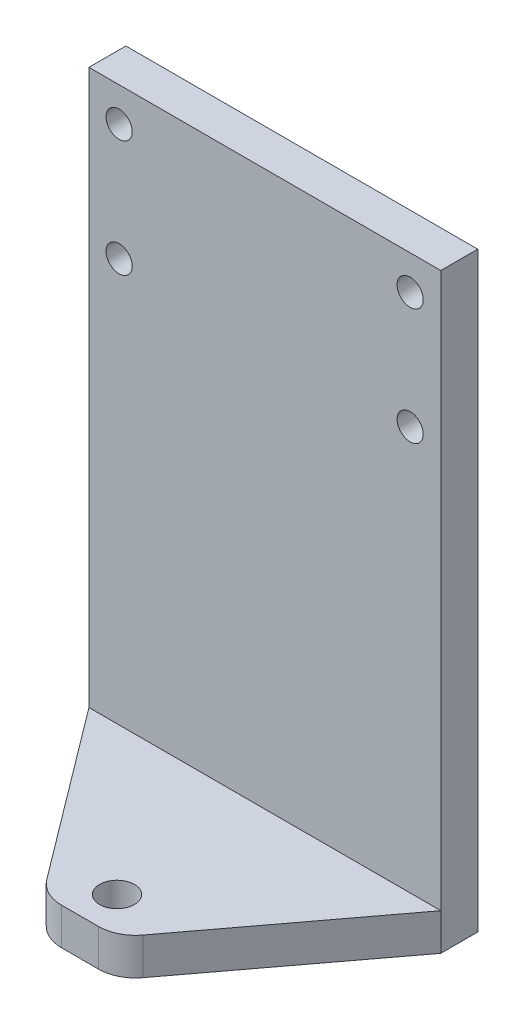
from build123d import *

# Parameters (mm, degrees)
SKETCH1_W           = 60.452
SKETCH1_H           = 101.6
BOSS_EXTRUDE1_DEPTH = 3.175
SKETCH2_W           = 60.452
SKETCH2_H           = 57.15
BOSS_EXTRUDE2_DEPTH = 6.35
SKETCH3_R           = 2.25
CUT_EXTRUDE1_DEPTH  = 83.221490962
SKETCH4_R           = 3
CUT_EXTRUDE2_DEPTH  = 114.575852191
CUT_EXTRUDE3_DEPTH  = 114.575852191
FILLET1_R           = 6.35


with BuildPart() as part:
    # Sketch1 → Boss-Extrude1 (new, symmetric)
    with BuildSketch(Plane.XY):
        Rectangle(SKETCH1_W, SKETCH1_H)
    extrude(amount=BOSS_EXTRUDE1_DEPTH, both=True)

    # Sketch2 → Boss-Extrude2 (add)
    with BuildSketch(Plane.XZ.offset(50.8)):
        with Locations((0, 25.4)):
            Rectangle(SKETCH2_W, SKETCH2_H)
    extrude(amount=-BOSS_EXTRUDE2_DEPTH)

    # Sketch3 → Cut-Extrude1 (cut, through all)
    with BuildSketch(Plane(origin=(0, 0, -3.175), x_dir=(-1, 0, 0), z_dir=(0, 0, -1))):
        with Locations((-24.964361496, 44.925)):
            Circle(SKETCH3_R)
        with Locations((-24.964361496, 24.925)):
            Circle(SKETCH3_R)
        with Locations((25.035638504, 24.925)):
            Circle(SKETCH3_R)
        with Locations((25.035638504, 44.925)):
            Circle(SKETCH3_R)
    extrude(amount=-CUT_EXTRUDE1_DEPTH, mode=Mode.SUBTRACT)

    # Sketch4 → Cut-Extrude2 (cut, through all)
    with BuildSketch(Plane(origin=(0, -44.45, 0), x_dir=(1, 0, 0), z_dir=(0, 1, 0))):
        with Locations((0, -28.575)):
            Circle(SKETCH4_R)
    extrude(amount=-CUT_EXTRUDE2_DEPTH, mode=Mode.SUBTRACT)

    # Sketch5 → Cut-Extrude3 (cut, through all)
    with BuildSketch(Plane(origin=(0, -44.45, 0), x_dir=(1, 0, 0), z_dir=(0, 1, 0))):
        Polygon((-30.226, -3.175), (-6.35, -34.925), (6.35, -34.925), (30.226, -3.175), (30.226, -53.975), (-30.226, -53.975), align=None)
    extrude(amount=-CUT_EXTRUDE3_DEPTH, mode=Mode.SUBTRACT)

    # Fillet1
    fillet1_edges = [part.edges().sort_by_distance(p)[0] for p in [
        (6.35, -47.625, 34.925),
        (-6.35, -47.625, 34.925),
    ]]
    fillet(fillet1_edges, radius=FILLET1_R)


solid = part.part
